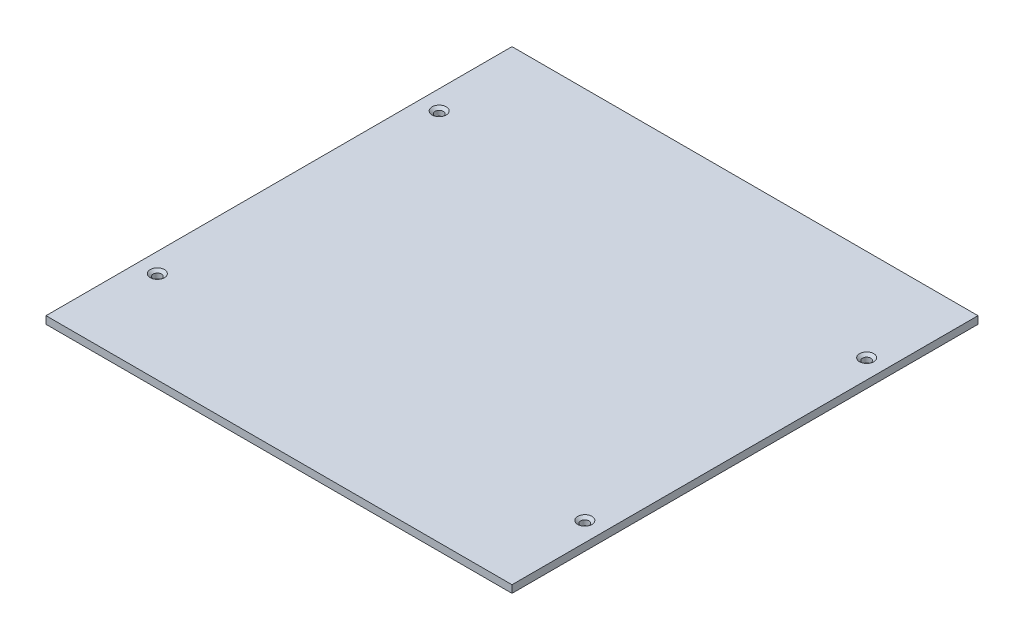
from build123d import *

# Parameters (mm, degrees)
SKETCH1_W                                         = 99.2004
SKETCH1_H                                         = 99.2004
BOSS_EXTRUDE1_DEPTH                               = 1.6002
CSK_FOR_0_FLAT_HEAD_MACHINE_SCREW_100_D           = 1.778
CSK_FOR_0_FLAT_HEAD_MACHINE_SCREW_100_CSINK_D     = 3.0226
CSK_FOR_0_FLAT_HEAD_MACHINE_SCREW_100_CSINK_ANGLE = 100


with BuildPart() as part:
    # Sketch1 → Boss-Extrude1 (new body)
    with BuildSketch(Plane(origin=(0, 0, 0), x_dir=(1, 0, 0), z_dir=(0, 1, 0))):
        with Locations((49.6002, 49.6002)):
            Rectangle(SKETCH1_W, SKETCH1_H)
    extrude(amount=BOSS_EXTRUDE1_DEPTH)

    # CSK for #0 Flat Head Machine Screw (100)1 (through all)
    with Locations(Plane(origin=(0, 1.6002, 0), x_dir=(1, 0, 0), z_dir=(0, 1, 0))):
        with Locations((4.1002, 79.6002), (4.1002, 19.6002), (95.1002, 19.6002), (95.1002, 79.6002)):
            CounterSinkHole(CSK_FOR_0_FLAT_HEAD_MACHINE_SCREW_100_D / 2, CSK_FOR_0_FLAT_HEAD_MACHINE_SCREW_100_CSINK_D / 2, counter_sink_angle=CSK_FOR_0_FLAT_HEAD_MACHINE_SCREW_100_CSINK_ANGLE)


solid = part.part
